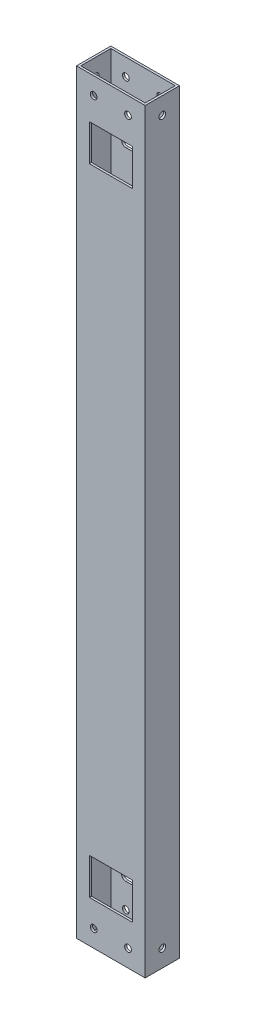
from build123d import *

# Parameters (mm, degrees)
SKETCH1_W               = 50.8
SKETCH1_H               = 558.8
BOSS_EXTRUDE1_DEPTH     = 12.7
SHELL1_T                = -1.5875
CUT_EXTRUDE1_DEPTH      = 281.839473721
CUT_EXTRUDE1_DEPTH_BACK = 281.839473721
SKETCH2_R               = 2.4892
CUT_EXTRUDE2_DEPTH      = 281.839473721
CUT_EXTRUDE2_DEPTH_BACK = 281.839473721
SKETCH3_R               = 2.4892
SKETCH4_W               = 31.75
SKETCH4_H               = 26.9875
CUT_EXTRUDE3_DEPTH      = 281.839473721
FILLET1_R               = 3.175
FILLET1_OF_MIRROR1_R    = 3.175


with BuildPart() as part:
    # Sketch1 → Boss-Extrude1 (new, symmetric)
    with BuildSketch(Plane.XY):
        Rectangle(SKETCH1_W, SKETCH1_H)
    extrude(amount=BOSS_EXTRUDE1_DEPTH, both=True)

    # Shell1
    shell1_openings = [part.faces().sort_by_distance(p)[0] for p in [
        (0, -279.4, 0),
        (0, 279.4, 0),
    ]]
    offset(amount=SHELL1_T, openings=shell1_openings, kind=Kind.INTERSECTION)

    # Sketch2 → Cut-Extrude1 (cut, two sides: drawn at the far end of the back side and taken through both)
    with BuildSketch(Plane.XY.offset(-CUT_EXTRUDE1_DEPTH_BACK)):
        with Locations((-12.7, -266.7)):
            Circle(SKETCH2_R)
        with Locations((12.7, -266.7)):
            Circle(SKETCH2_R)
        with Locations((12.7, 266.7)):
            Circle(SKETCH2_R)
        with Locations((-12.7, 266.7)):
            Circle(SKETCH2_R)
    extrude(amount=CUT_EXTRUDE1_DEPTH + CUT_EXTRUDE1_DEPTH_BACK, mode=Mode.SUBTRACT)

    # Sketch3 → Cut-Extrude2 (cut, two sides: drawn at the far end of the back side and taken through both)
    with BuildSketch(Plane(origin=(0, 0, 0), x_dir=(0, 0, -1), z_dir=(1, 0, 0)).offset(-CUT_EXTRUDE2_DEPTH_BACK)):
        with Locations((0, -266.7)):
            Circle(SKETCH3_R)
        with Locations((0, 266.7)):
            Circle(SKETCH3_R)
    extrude(amount=CUT_EXTRUDE2_DEPTH + CUT_EXTRUDE2_DEPTH_BACK, mode=Mode.SUBTRACT)

    # Sketch4 → Cut-Extrude3 (cut, symmetric)
    with BuildSketch(Plane.XY):
        with Locations((0, 234.95)):
            Rectangle(SKETCH4_W, SKETCH4_H)
    cut_extrude3 = extrude(amount=CUT_EXTRUDE3_DEPTH, both=True, mode=Mode.SUBTRACT)

    # Fillet1
    fillet1_edges = [part.edges().sort_by_distance(p)[0] for p in [
        (-15.875, 248.44375, -11.90625),
        (15.875, 221.45625, -11.90625),
        (-15.875, 221.45625, -11.90625),
        (15.875, 248.44375, -11.90625),
    ]]
    fillet(fillet1_edges, radius=FILLET1_R)

    # Mirror1: Cut-Extrude3 across plane
    add(cut_extrude3.mirror(Plane.ZX), mode=Mode.SUBTRACT)

    # Fillet1 of Mirror1
    fillet1_of_mirror1_edges = [part.edges().sort_by_distance(p)[0] for p in [
        (-15.875, -248.44375, -11.90625),
        (15.875, -221.45625, -11.90625),
        (-15.875, -221.45625, -11.90625),
        (15.875, -248.44375, -11.90625),
    ]]
    fillet(fillet1_of_mirror1_edges, radius=FILLET1_OF_MIRROR1_R)


solid = part.part
